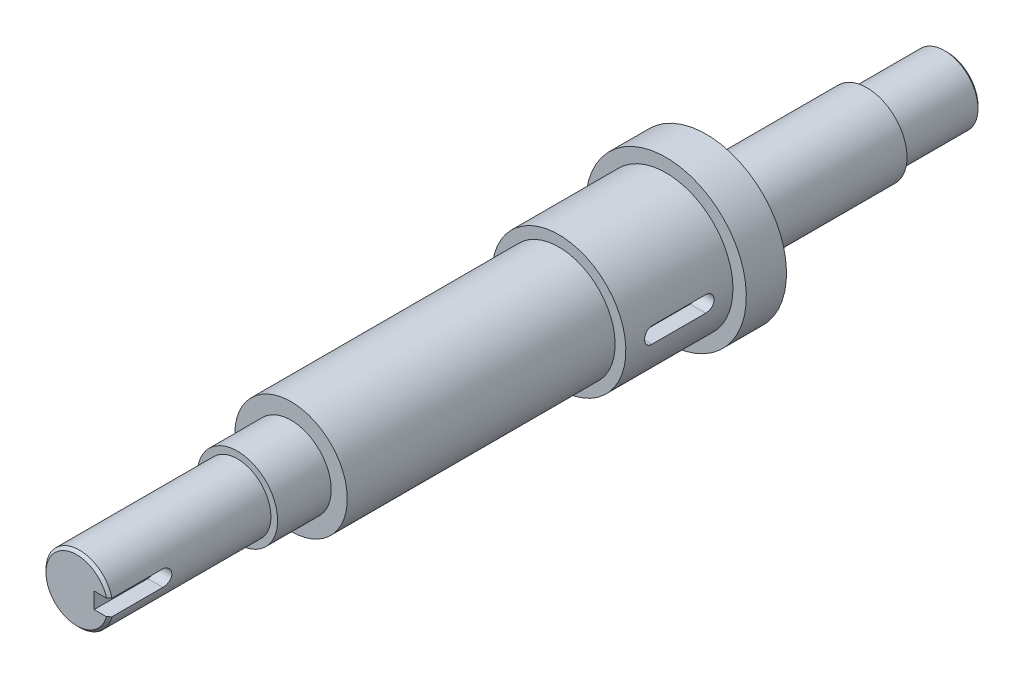
from build123d import *

# Parameters (mm, degrees)
M8X1_0_TAPPED_HOLE1_D     = 7
M8X1_0_TAPPED_HOLE1_DEPTH = 19
M8X1_0_TAPPED_HOLE1_TIP   = 2.103012167
CUT_EXTRUDE3_DEPTH        = 6
CUT_EXTRUDE4_DEPTH        = 6
CHAMFER1_SIZE             = 1


with BuildPart() as part:
    # Sketch2 → Revolve1 (revolve)
    with BuildSketch(Plane(origin=(0, 0, 0), x_dir=(0, 0, -1), z_dir=(1, 0, 0))):
        Polygon((-225, 12.5), (-225, 0), (100, 0), (100, 12.5), (70, 12.5), (70, 15), (10, 15), (10, 30), (-5, 30), (-5, 25), (-45, 25), (-45, 21), (-145, 21), (-145, 15), (-165, 15), (-165, 12.5), align=None)
    revolve(axis=Axis((0, 0, 225), (0, 0, -1)))

    # M8x1.0 Tapped Hole1
    with Locations(Plane(origin=(0, 0, -100), x_dir=(0, -1, 0), z_dir=(0, 0, -1))):
        with Locations((0, 0)):
            Hole(M8X1_0_TAPPED_HOLE1_D / 2, depth=M8X1_0_TAPPED_HOLE1_DEPTH)
            with Locations((0, 0, -(M8X1_0_TAPPED_HOLE1_DEPTH + M8X1_0_TAPPED_HOLE1_TIP / 2))):  # 118° drill point
                Cone(0, M8X1_0_TAPPED_HOLE1_D / 2, M8X1_0_TAPPED_HOLE1_TIP, mode=Mode.SUBTRACT)

    # Sketch4 → Cut-Extrude3 (cut)
    with BuildSketch(Plane(origin=(12.5, 0, 0), x_dir=(0, 0, -1), z_dir=(1, 0, 0))):
        with BuildLine():
            Line((-205, 3), (-225, 3))
            Line((-225, 3), (-225, -3))
            Line((-225, -3), (-205, -3))
            ThreePointArc((-205, -3), (-202, 0), (-205, 3))
        make_face()
    extrude(amount=-CUT_EXTRUDE3_DEPTH, mode=Mode.SUBTRACT)

    # Sketch5 → Cut-Extrude4 (cut)
    with BuildSketch(Plane(origin=(25, 0, 0), x_dir=(0, 0, -1), z_dir=(1, 0, 0))):
        with BuildLine():
            Line((-35, 3), (-15, 3))
            ThreePointArc((-15, 3), (-12, 0), (-15, -3))
            Line((-15, -3), (-35, -3))
            ThreePointArc((-35, -3), (-38, 0), (-35, 3))
        make_face()
    extrude(amount=-CUT_EXTRUDE4_DEPTH, mode=Mode.SUBTRACT)

    # Chamfer1
    chamfer1_edges = [part.edges().sort_by_distance(p)[0] for p in [
        (-9.842509843, -7.705517504, 225),
        (0, -12.5, -100),
    ]]
    chamfer(chamfer1_edges, length=CHAMFER1_SIZE)


solid = part.part
